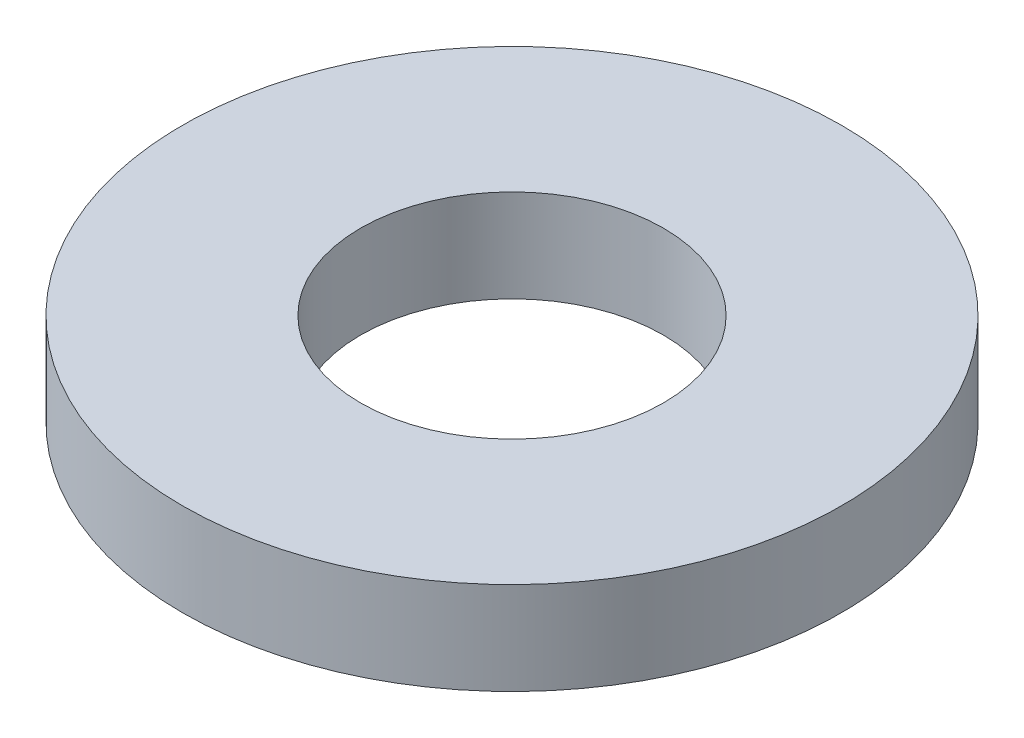
from build123d import *

# Parameters (mm, degrees)
SKETCH1_R           = 92.5
BOSS_EXTRUDE1_DEPTH = 26
SKETCH2_R           = 42.5
CUT_EXTRUDE1_DEPTH  = 134.373535606


with BuildPart() as part:
    # Sketch1 → Boss-Extrude1 (new body)
    with BuildSketch(Plane(origin=(0, 0, 0), x_dir=(1, 0, 0), z_dir=(0, 1, 0))):
        Circle(SKETCH1_R)
    extrude(amount=BOSS_EXTRUDE1_DEPTH)

    # Sketch2 → Cut-Extrude1 (cut, through all)
    with BuildSketch(Plane(origin=(0, 0, 0), x_dir=(1, 0, 0), z_dir=(0, 1, 0))):
        Circle(SKETCH2_R)
    extrude(amount=CUT_EXTRUDE1_DEPTH, mode=Mode.SUBTRACT)


solid = part.part
